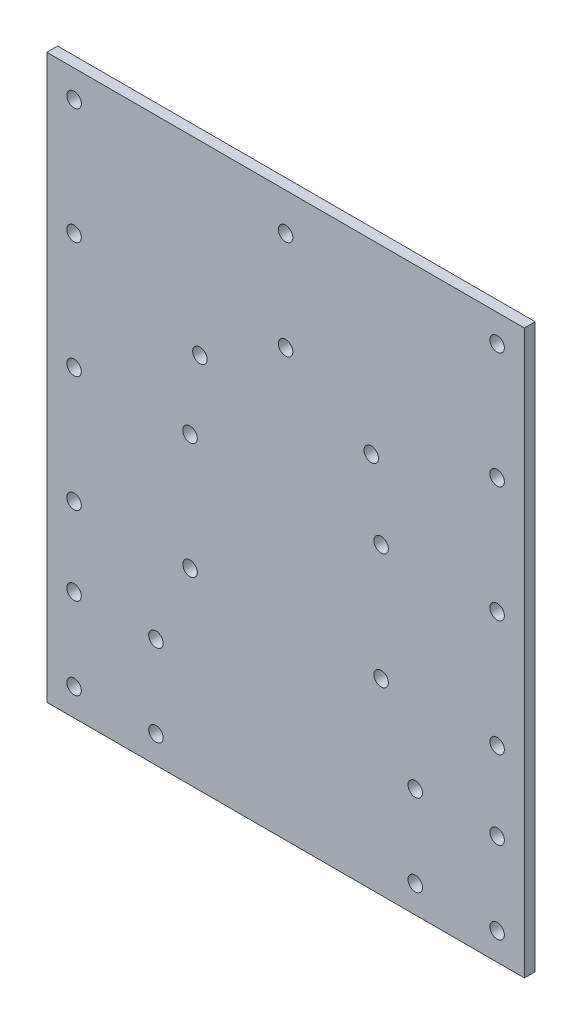
from build123d import *

# Parameters (mm, degrees)
SKETCH1_W           = 140
SKETCH1_H           = 165
SKETCH1_R           = 2.125
BOSS_EXTRUDE1_DEPTH = 3.175
SKETCH2_R           = 2.125
CUT_EXTRUDE1_DEPTH  = 109.242000282


with BuildPart() as part:
    # Sketch1 → Boss-Extrude1 (new body)
    with BuildSketch(Plane.XY):
        Rectangle(SKETCH1_W, SKETCH1_H)
        with Locations((0, 71.5)):
            Circle(SKETCH1_R, mode=Mode.SUBTRACT)
        with Locations((25.11473671, 28)):
            Circle(SKETCH1_R, mode=Mode.SUBTRACT)
        with Locations((-25.11473671, 28)):
            Circle(SKETCH1_R, mode=Mode.SUBTRACT)
        with Locations((0, 42.5)):
            Circle(SKETCH1_R, mode=Mode.SUBTRACT)
        with Locations((-62, -74.5)):
            Circle(SKETCH1_R, mode=Mode.SUBTRACT)
        with Locations((-38, -74.5)):
            Circle(SKETCH1_R, mode=Mode.SUBTRACT)
        with Locations((-38, -50.5)):
            Circle(SKETCH1_R, mode=Mode.SUBTRACT)
        with Locations((-62, -50.5)):
            Circle(SKETCH1_R, mode=Mode.SUBTRACT)
        with Locations((38, -74.5)):
            Circle(SKETCH1_R, mode=Mode.SUBTRACT)
        with Locations((62, -74.5)):
            Circle(SKETCH1_R, mode=Mode.SUBTRACT)
        with Locations((62, -50.5)):
            Circle(SKETCH1_R, mode=Mode.SUBTRACT)
        with Locations((38, -50.5)):
            Circle(SKETCH1_R, mode=Mode.SUBTRACT)
    extrude(amount=BOSS_EXTRUDE1_DEPTH)

    # Sketch2 → Cut-Extrude1 (cut, through all)
    with BuildSketch(Plane.XY.offset(3.175)):
        with Locations((-62, 74.5)):
            Circle(SKETCH2_R)
        with Locations((-62, 40.5)):
            Circle(SKETCH2_R)
        with Locations((-62, 6.5)):
            Circle(SKETCH2_R)
        with Locations((-62, -27.5)):
            Circle(SKETCH2_R)
        with Locations((-28, 6.5)):
            Circle(SKETCH2_R)
        with Locations((-28, -27.5)):
            Circle(SKETCH2_R)
        with Locations((28, -27.5)):
            Circle(SKETCH2_R)
        with Locations((28, 6.5)):
            Circle(SKETCH2_R)
        with Locations((62, -27.5)):
            Circle(SKETCH2_R)
        with Locations((62, 6.5)):
            Circle(SKETCH2_R)
        with Locations((62, 40.5)):
            Circle(SKETCH2_R)
        with Locations((62, 74.5)):
            Circle(SKETCH2_R)
    extrude(amount=-CUT_EXTRUDE1_DEPTH, mode=Mode.SUBTRACT)


solid = part.part
